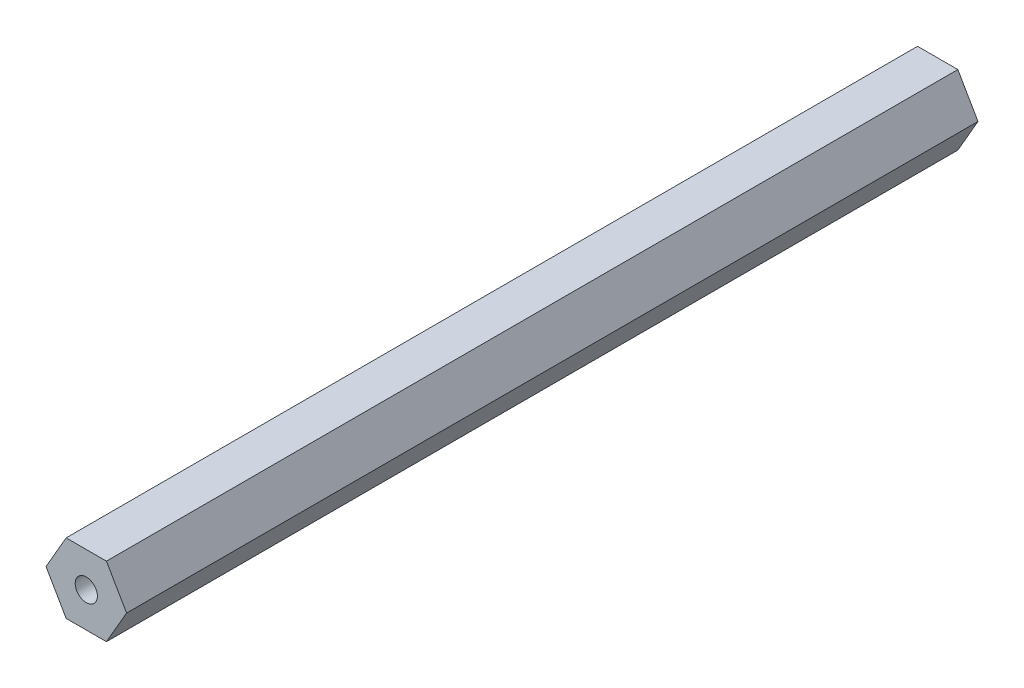
from build123d import *

# Parameters (mm, degrees)
BOSS_EXTRUDE1_DEPTH        = 154.94
F_10_32_TAPPED_HOLE1_D     = 4.0386
F_10_32_TAPPED_HOLE1_DEPTH = 76.2
F_10_32_TAPPED_HOLE1_TIP   = 1.213317848


with BuildPart() as part:
    # Sketch1 → Boss-Extrude1 (new body)
    with BuildSketch(Plane.XY):
        Polygon((7.332348419, 0), (3.666174209, 6.35), (-3.666174209, 6.35), (-7.332348419, 0), (-3.666174209, -6.35), (3.666174209, -6.35), align=None)
    extrude(amount=BOSS_EXTRUDE1_DEPTH)

    # #10-32 Tapped Hole1
    with Locations(Plane.XY.offset(154.94)):
        with Locations((0, 0)):
            Hole(F_10_32_TAPPED_HOLE1_D / 2, depth=F_10_32_TAPPED_HOLE1_DEPTH)
            with Locations((0, 0, -(F_10_32_TAPPED_HOLE1_DEPTH + F_10_32_TAPPED_HOLE1_TIP / 2))):  # 118° drill point
                Cone(0, F_10_32_TAPPED_HOLE1_D / 2, F_10_32_TAPPED_HOLE1_TIP, mode=Mode.SUBTRACT)


solid = part.part
